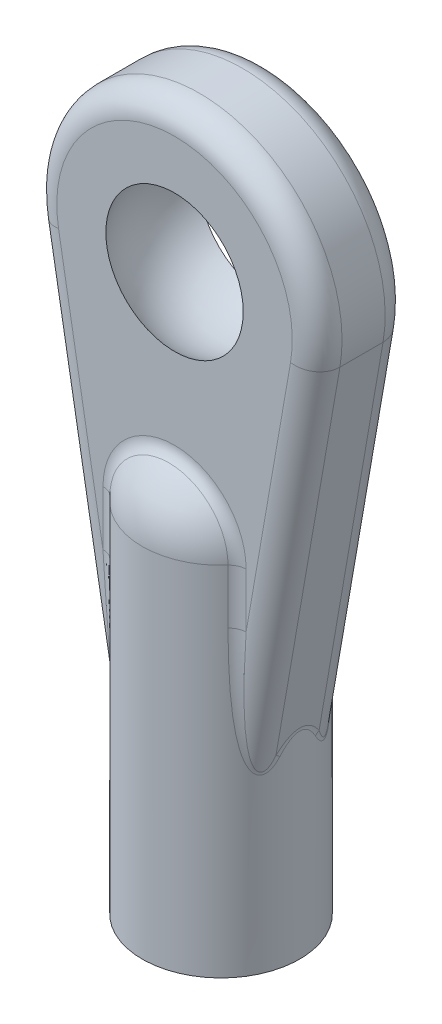
from build123d import *

# Parameters (mm, degrees)
BOSS_EXTRUDE1_DEPTH   = 1.4
FILLET1_R             = 0.75
FILLET2_R             = 0.5
M3_TAPPED_HOLE1_D     = 2.5
M3_TAPPED_HOLE1_DEPTH = 8.636
M3_TAPPED_HOLE1_TIP   = 0.7510757737844503


with BuildPart() as part:
    # Sketch1 → Boss-Extrude1 (new, symmetric)
    with BuildSketch(Plane.XY):
        with BuildLine():
            Line((2.375000000000002, -11.45), (4.23652800296372, -0.7360913530970443))
            ThreePointArc((4.23652800296372, -0.7360913530970443), (2.6e-16, 4.3), (-4.236528002963721, -0.7360913530970459))
            Line((-4.236528002963721, -0.7360913530970459), (-2.3749999999999982, -11.45))
            Line((-2.3749999999999982, -11.45), (-2.201251271658748, -12.45))
            Line((-2.201251271658748, -12.45), (2.2012512716587507, -12.45))
            Line((2.2012512716587507, -12.45), (2.375000000000002, -11.45))
        make_face()
    extrude(amount=BOSS_EXTRUDE1_DEPTH, both=True)

    # Sketch2 → Revolve1 (revolve)
    with BuildSketch(Plane.XY):
        with BuildLine():
            Line((2.14e-15, -17.45), (-2.3749999999999982, -17.45))
            Line((-2.3749999999999982, -17.45), (-2.3749999999999982, -11.45))
            Line((-2.3749999999999982, -11.45), (-2.3749999999999982, -6.674999999999999))
            ThreePointArc((-2.3749999999999982, -6.674999999999999), (-1.6793786053180495, -4.995621394681949), (5.2e-16, -4.3))
            Line((5.2e-16, -4.3), (0, -6.674999999999999))
            Line((0, -6.674999999999999), (2.14e-15, -17.45))
        make_face()
    revolve(axis=Axis((0, 0, 0), (1.2e-16, -1, 0)))

    # Sketch3 → Cut-Revolve1 (revolve, cut)
    with BuildSketch(Plane(origin=(0, 0, 0), x_dir=(0, 0, -1), z_dir=(1, 0, 0))):
        with BuildLine():
            Line((0, -2.5), (0, 2.5))
            ThreePointArc((0, 2.5), (-2.5, 3.1e-16), (0, -2.5))
        make_face()
    revolve(axis=Axis((0, -2.5, 0), (0, 1, 0)), mode=Mode.SUBTRACT)

    # Fillet1
    fillet1_edges = [part.edges().sort_by_distance(p)[0] for p in [
        (3.2188896373112352, -6.593045676548522, -1.4),
        (-1.33e-15, 4.3, -1.4),
        (3.2188896373112352, -6.593045676548521, 1.4),
        (-1.33e-15, 4.3, 1.4),
        (-3.218889637311235, -6.593045676548522, -1.4),
        (-3.218889637311235, -6.593045676548522, 1.4),
    ]]
    fillet(fillet1_edges, radius=FILLET1_R)

    # Fillet2
    fillet2_edges = [part.edges().sort_by_distance(p)[0] for p in [
        (1.9184955042949687, -8.185566780342553, -1.4),
        (1.8e-16, -4.756504495705033, -1.4),
        (1.9184955042949687, -8.185566780342551, 1.4),
        (1.8e-16, -4.756504495705033, 1.4),
        (-1.9184955042949665, -8.185566780342551, -1.4),
        (-1.9184955042949665, -8.185566780342553, 1.4),
    ]]
    fillet(fillet2_edges, radius=FILLET2_R)

    # M3 Tapped Hole1
    with Locations(Plane(origin=(2.14e-15, -17.45, 0), x_dir=(-1, -1.2e-16, 0), z_dir=(1.2e-16, -1, 0))):
        with Locations((0, 0)):
            Hole(M3_TAPPED_HOLE1_D / 2, depth=M3_TAPPED_HOLE1_DEPTH)
            with Locations((0, 0, -(M3_TAPPED_HOLE1_DEPTH + M3_TAPPED_HOLE1_TIP / 2))):  # 118° drill point
                Cone(0, M3_TAPPED_HOLE1_D / 2, M3_TAPPED_HOLE1_TIP, mode=Mode.SUBTRACT)


solid = part.part
